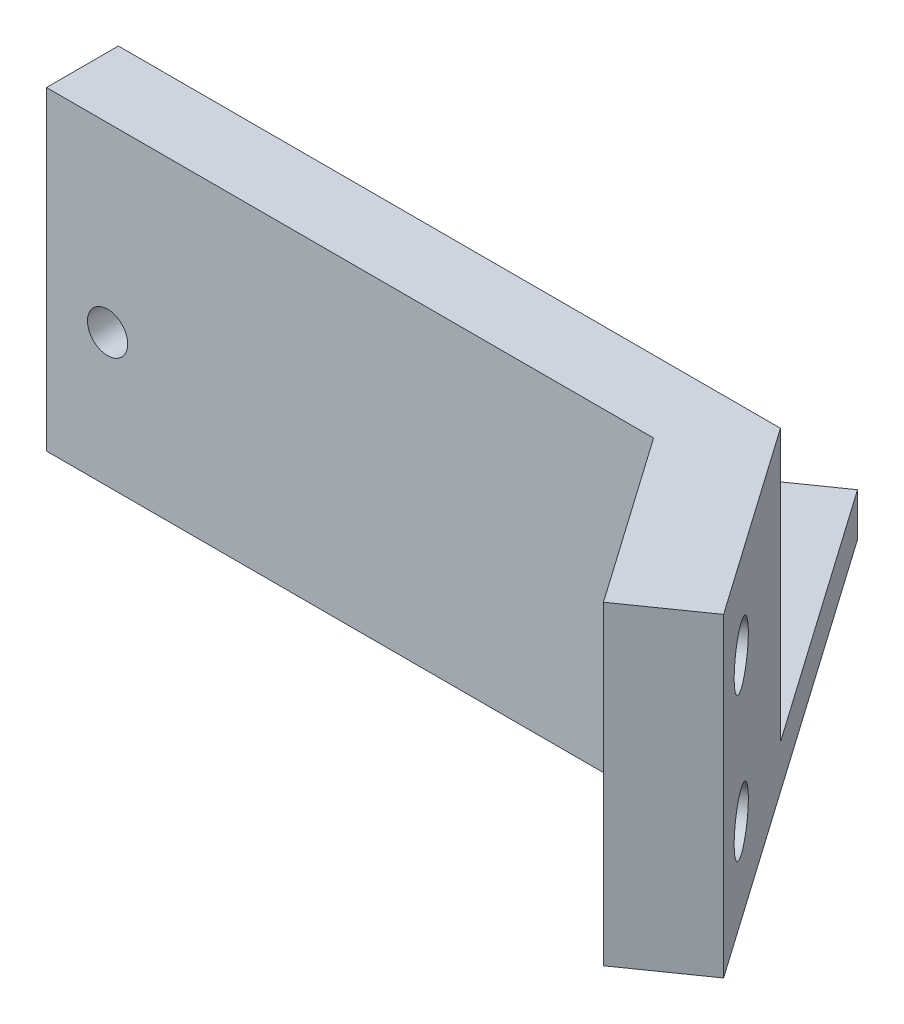
from build123d import *

# Parameters (mm, degrees)
SKETCH1_R            = 1.4
BOSS_EXTRUDE1_DEPTH  = 5
BOSS_EXTRUDE9_DEPTH  = 18.9
SKETCH1_4_R          = 1.4
CUT_EXTRUDE4_DEPTH   = 5
BOSS_EXTRUDE10_REACH = 49.608
SKETCH5_W            = 27.928634905
SKETCH5_H            = 3
SKETCH8_W            = 10
SKETCH8_H            = 21.9
SKETCH8_R            = 2
BOSS_EXTRUDE11_DEPTH = 3
SKETCH8_3_W          = 10
SKETCH8_3_H          = 21.9
BOSS_EXTRUDE12_DEPTH = 6
BOSS_EXTRUDE13_START = -3
BOSS_EXTRUDE13_DEPTH = 21.9
CUT_EXTRUDE5_DEPTH   = 6
BOSS_EXTRUDE14_DEPTH = 5
SKETCH11_2_W         = 8
SKETCH11_2_H         = 5
BOSS_EXTRUDE15_DEPTH = 3
SKETCH12_W           = 8
SKETCH12_H           = 5
CUT_EXTRUDE6_DEPTH   = 18.6


# Read off the part's stored shape, not the designer's step: Boss-Extrude9, Boss-Extrude13, Boss-Extrude14
with BuildPart() as part:
    # Sketch1 → Boss-Extrude1 (new body)
    with BuildSketch(Plane.XY):
        with BuildLine():
            Line((3.38, 2.541421507), (0, 2.523123532))
            Line((0, 2.523123532), (0, 0))
            Line((0, 0), (-29.5, 0))
            Line((-29.5, 0), (-29.5, 2.523123532))
            Line((-29.5, 2.523123532), (-32.88, 2.523123532))
            ThreePointArc((-32.88, 2.523123532), (-37.018209124, 6.273123532), (-32.88, 10.023123532))
            Line((-32.88, 10.023123532), (-29.5, 10.023123532))
            Line((-29.5, 10.023123532), (-29.5, 18.9))
            Line((-29.5, 18.9), (0, 18.9))
            Line((0, 18.9), (0, 10.023123532))
            Line((0, 10.023123532), (3.75, 10.023123532))
            ThreePointArc((3.75, 10.023123532), (7.495422713, 6.087897443), (3.38, 2.541421507))
        make_face()
        with Locations((3.75, 6.273123532)):
            Circle(SKETCH1_R, mode=Mode.SUBTRACT)
        with Locations((-33.25, 6.273123532)):
            Circle(SKETCH1_R, mode=Mode.SUBTRACT)
    extrude(amount=BOSS_EXTRUDE1_DEPTH)

    # Boss-Extrude9 outline → Boss-Extrude9 (add)
    with BuildSketch(Plane(origin=(0, 0, 0), x_dir=(1, 0, 0), z_dir=(0, 1, 0))):
        Polygon((0, -5), (12.051348998, -5), (8.550311307, 0), (0, 0), align=None)
    extrude(amount=BOSS_EXTRUDE9_DEPTH)

    # Sketch1<4> → Cut-Extrude4 (cut)
    with BuildSketch(Plane.XY):
        with Locations((3.75, 6.273123532)):
            Circle(SKETCH1_4_R)
    extrude(amount=CUT_EXTRUDE4_DEPTH, mode=Mode.SUBTRACT)

    # Boss-Extrude10: up to this face of the body (flat: up to its plane)
    boss_extrude10_end = Plane(part.part.faces().sort_by_distance((-10.115754309, 9.30291887, 5))[0])
    # Sketch5 → Boss-Extrude10 (add, up to the picked face)
    with BuildSketch(Plane(origin=(5.737345003, 0, -4.01733222), x_dir=(0.5735764363510504, 0, 0.8191520442889888), z_dir=(-0.8191520442889888, 0, 0.5735764363510504)), mode=Mode.PRIVATE) as boss_extrude10_sk1:
        with Locations((-2.95618742, -1.5)):
            Rectangle(SKETCH5_W, SKETCH5_H)
    boss_extrude10_tool1 = split(extrude(boss_extrude10_sk1.sketch, amount=BOSS_EXTRUDE10_REACH, mode=Mode.PRIVATE), bisect_by=boss_extrude10_end, keep=Keep.BOTH, mode=Mode.PRIVATE)
    add(boss_extrude10_tool1.solids().sort_by(Axis((4.041746, -1.5, -6.438899), (-0.8191520442889888, 0, 0.5735764363510504)))[0])



with BuildPart() as body_2:
    # Sketch8 → Boss-Extrude11 (new body)
    # profile 1 of 3: a face of its own
    with BuildSketch(Plane(origin=(5.737345003, 0, -4.01733222), x_dir=(0.5735764363510504, 0, 0.8191520442889888), z_dir=(-0.8191520442889888, 0, 0.5735764363510504))):
        with Locations((16.008130033, 7.95)):
            Rectangle(SKETCH8_W, SKETCH8_H)
        Polygon((19.408130033, 14.912990915), (16.008130033, 16.87598183), (12.608130033, 14.912990915), (12.608130033, 10.987009085), (16.008130033, 9.02401817), (19.408130033, 10.987009085), align=None, mode=Mode.SUBTRACT)
        Polygon((16.008130033, 6.87598183), (12.608130033, 4.912990915), (12.608130033, 0.987009085), (16.008130033, -0.97598183), (19.408130033, 0.987009085), (19.408130033, 4.912990915), align=None, mode=Mode.SUBTRACT)
    # profile 2 of 3: a face of its own
    with BuildSketch(Plane(origin=(5.737345003, 0, -4.01733222), x_dir=(0.5735764363510504, 0, 0.8191520442889888), z_dir=(-0.8191520442889888, 0, 0.5735764363510504))):
        Polygon((19.408130033, 4.912990915), (16.008130033, 6.87598183), (12.608130033, 4.912990915), (12.608130033, 0.987009085), (16.008130033, -0.97598183), (19.408130033, 0.987009085), align=None)
        with Locations(Location((16.008130033, 2.95, 0), (0, 0, 180))):
            Circle(SKETCH8_R, mode=Mode.SUBTRACT)
    # profile 3 of 3: a face of its own
    with BuildSketch(Plane(origin=(5.737345003, 0, -4.01733222), x_dir=(0.5735764363510504, 0, 0.8191520442889888), z_dir=(-0.8191520442889888, 0, 0.5735764363510504))):
        Polygon((19.408130033, 10.987009085), (19.408130033, 14.912990915), (16.008130033, 16.87598183), (12.608130033, 14.912990915), (12.608130033, 10.987009085), (16.008130033, 9.02401817), align=None)
        with Locations(Location((16.008130033, 12.95, 0), (0, 0, 180))):
            Circle(SKETCH8_R, mode=Mode.SUBTRACT)
    extrude(amount=BOSS_EXTRUDE11_DEPTH)

    # Sketch8<3> → Boss-Extrude12 (add)
    with BuildSketch(Plane(origin=(5.737345003, 0, -4.01733222), x_dir=(0.5735764363510504, 0, 0.8191520442889888), z_dir=(-0.8191520442889888, 0, 0.5735764363510504))):
        with Locations((16.008130033, 7.95)):
            Rectangle(SKETCH8_3_W, SKETCH8_3_H)
        Polygon((19.408130033, 14.912990915), (16.008130033, 16.87598183), (12.608130033, 14.912990915), (12.608130033, 10.987009085), (16.008130033, 9.02401817), (19.408130033, 10.987009085), align=None, mode=Mode.SUBTRACT)
        Polygon((16.008130033, 6.87598183), (12.608130033, 4.912990915), (12.608130033, 0.987009085), (16.008130033, -0.97598183), (19.408130033, 0.987009085), (19.408130033, 4.912990915), align=None, mode=Mode.SUBTRACT)
    extrude(amount=BOSS_EXTRUDE12_DEPTH)


with BuildPart() as part_1:
    add(part.part)

    add(body_2.part)  # Boss-Extrude13 merges body 2
    # Boss-Extrude13 outline → Boss-Extrude13 (add)
    with BuildSketch(Plane(origin=(0, 0, 0), x_dir=(1, 0, 0), z_dir=(0, 1, 0)).offset(BOSS_EXTRUDE13_START)):
        Polygon((12.051348998, -5), (4.726701466, -5), (7.136436733, -8.441458618), align=None)
    extrude(amount=BOSS_EXTRUDE13_DEPTH)

    # Sketch10 → Cut-Extrude5 (cut)
    with BuildSketch(Plane.XY.offset(5)):
        Polygon((2.104551733, 9.123123532), (0.459103466, 6.273123532), (2.104551733, 3.423123532), (5.395448267, 3.423123532), (7.040896534, 6.273123532), (5.395448267, 9.123123532), align=None)
    extrude(amount=CUT_EXTRUDE5_DEPTH, mode=Mode.SUBTRACT)

    # Boss-Extrude14 outline → Boss-Extrude14 (add)
    with BuildSketch(Plane.XY):
        with BuildLine():
            Line((-29.5, 10.023123532), (-29.5, 37.5))
            Line((-29.5, 37.5), (-37.5, 37.5))
            Line((-37.5, 37.5), (-37.5, 0))
            Line((-37.5, 0), (-29.5, 0))
            Line((-29.5, 0), (-29.5, 2.523123532))
            Line((-29.5, 2.523123532), (-32.88, 2.523123532))
            ThreePointArc((-32.88, 2.523123532), (-37.018209124, 6.273123532), (-32.88, 10.023123532))
            Line((-32.88, 10.023123532), (-29.5, 10.023123532))
        make_face()
    extrude(amount=BOSS_EXTRUDE14_DEPTH)

    # Sketch11<2> → Boss-Extrude15 (add)
    with BuildSketch(Plane(origin=(0, 0, 0), x_dir=(1, 0, 0), z_dir=(0, 1, 0))):
        with Locations((-33.5, -2.5)):
            Rectangle(SKETCH11_2_W, SKETCH11_2_H)
    extrude(amount=-BOSS_EXTRUDE15_DEPTH)

    # Sketch12 → Cut-Extrude6 (cut)
    with BuildSketch(Plane(origin=(0, 37.5, 0), x_dir=(1, 0, 0), z_dir=(0, 1, 0))):
        with Locations((-33.5, -2.5)):
            Rectangle(SKETCH12_W, SKETCH12_H)
    extrude(amount=-CUT_EXTRUDE6_DEPTH, mode=Mode.SUBTRACT)


solid = part_1.part
